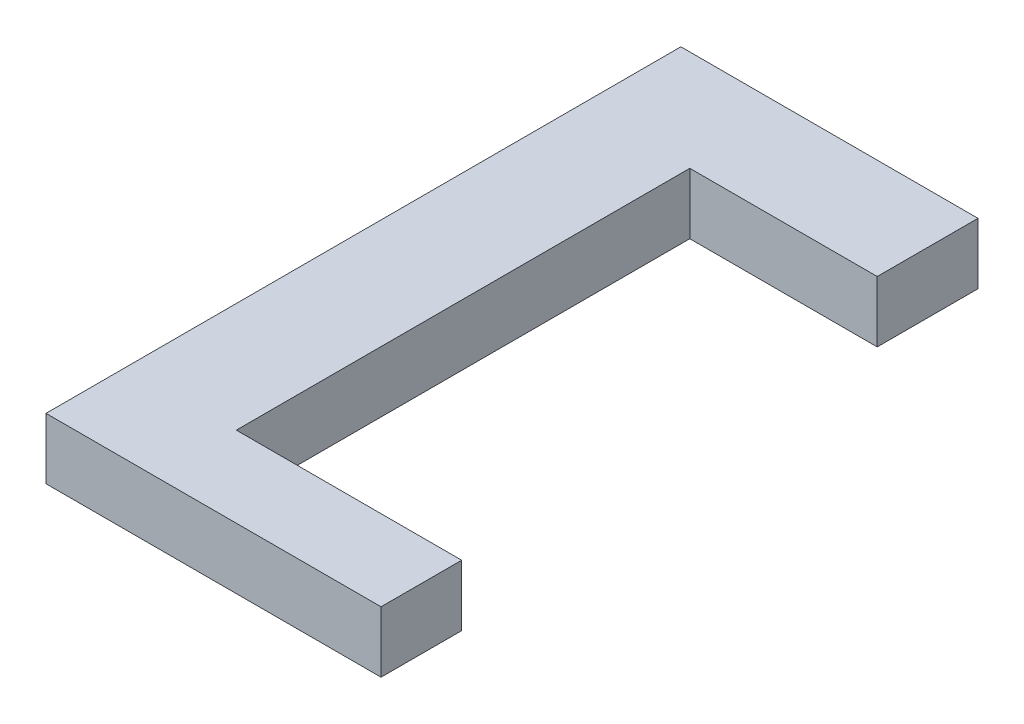
from build123d import *

# Parameters (mm, degrees)
CROQUIS1_W              = 66.493735553
CROQUIS1_H              = 12.107106782
SALIENTE_EXTRUIR1_DEPTH = 16
CROQUIS2_W              = 21.771957795
CROQUIS2_H              = 12.107106782
SALIENTE_EXTRUIR2_DEPTH = 110
CROQUIS3_W              = 58.965908173
CROQUIS3_H              = 12.107106782
SALIENTE_EXTRUIR3_DEPTH = 20


with BuildPart() as part:
    # Croquis1 → Saliente-Extruir1 (new body)
    with BuildSketch(Plane.XY):
        with Locations((-17.243314385, 0)):
            Rectangle(CROQUIS1_W, CROQUIS1_H)
    extrude(amount=SALIENTE_EXTRUIR1_DEPTH)

    # Croquis2 → Saliente-Extruir2 (add)
    with BuildSketch(Plane(origin=(0, 0, 0), x_dir=(-1, 0, 0), z_dir=(0, 0, -1))):
        with Locations((39.604203265, 0)):
            Rectangle(CROQUIS2_W, CROQUIS2_H)
    extrude(amount=SALIENTE_EXTRUIR2_DEPTH)

    # Croquis3 → Saliente-Extruir3 (add)
    with BuildSketch(Plane(origin=(0, 0, -110), x_dir=(-1, 0, 0), z_dir=(0, 0, -1))):
        with Locations((21.007228076, 0)):
            Rectangle(CROQUIS3_W, CROQUIS3_H)
    extrude(amount=-SALIENTE_EXTRUIR3_DEPTH)


solid = part.part
